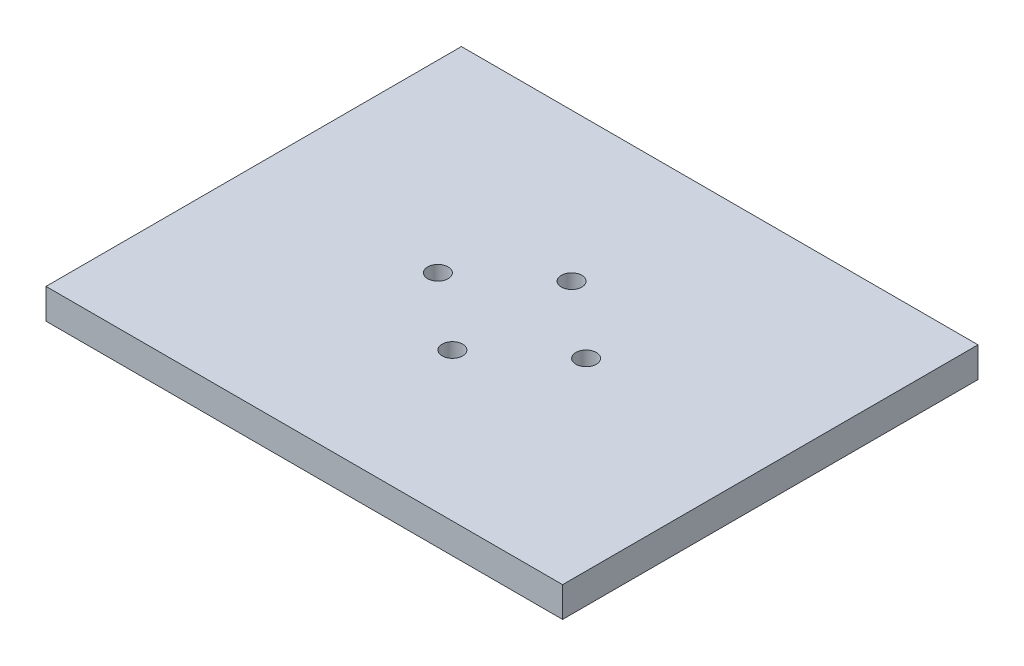
from build123d import *

# Parameters (mm, degrees)
SKETCH1_R           = 1.7
BOSS_EXTRUDE1_DEPTH = 5


with BuildPart() as part:
    # Sketch1 → Boss-Extrude1 (new body)
    with BuildSketch(Plane(origin=(0, 0, 0), x_dir=(1, 0, 0), z_dir=(0, 1, 0))):
        Polygon((42.825, 26.738412941), (42.825, 34.437743191), (33.250510286, 34.437743191), (-33.250510286, 34.437743191), (-42.825, 34.437743191), (-42.825, 26.738412941), (-42.825, -26.738412941), (-42.825, -34.437743191), (-33.250510286, -34.437743191), (33.250510286, -34.437743191), (42.825, -34.437743191), (42.825, -26.738412941), align=None)
        with Locations((0, -9.880807154)):
            Circle(SKETCH1_R, mode=Mode.SUBTRACT)
        with Locations((0, 9.880807154)):
            Circle(SKETCH1_R, mode=Mode.SUBTRACT)
        with Locations((12.287261799, 0)):
            Circle(SKETCH1_R, mode=Mode.SUBTRACT)
        with Locations((-12.287261799, 0)):
            Circle(SKETCH1_R, mode=Mode.SUBTRACT)
    extrude(amount=BOSS_EXTRUDE1_DEPTH)


solid = part.part
